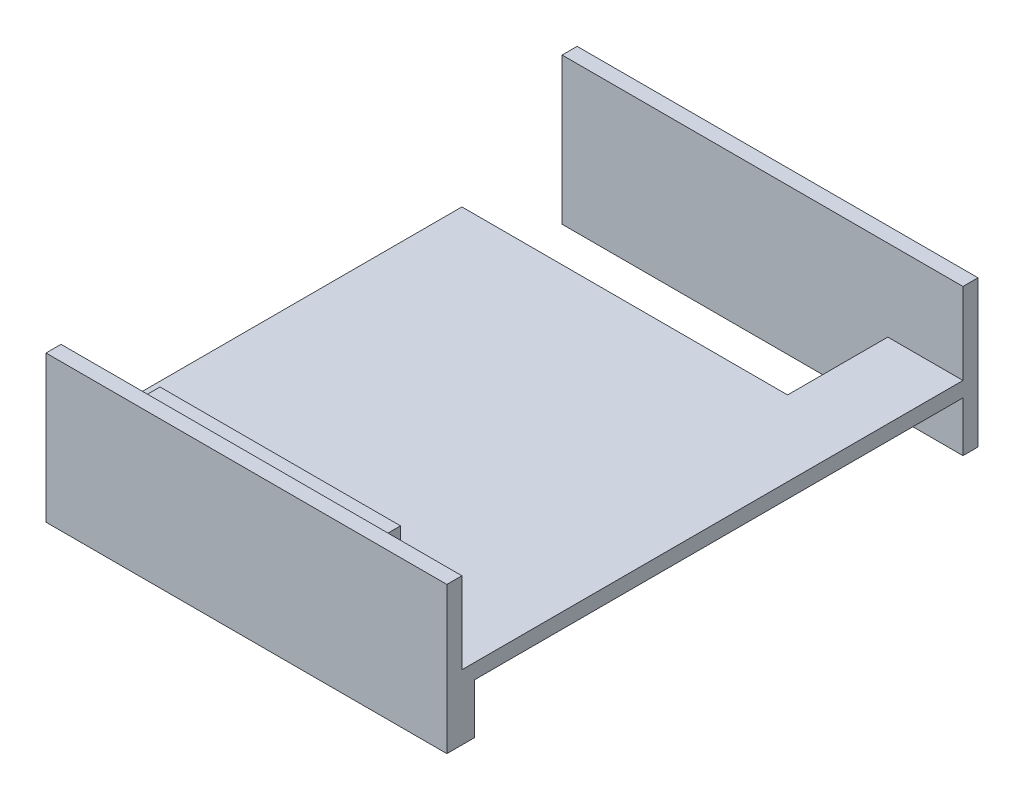
from build123d import *

# Parameters (mm, degrees)
EXTRUDE_309_DEPTH      = 1.2
SKETCH_2_W             = 32
SKETCH_2_H             = 1.2
PCB_DEPTH              = 6.5
PCB_2_DEPTH            = 6
CUT_EXTRUDE_1014_REACH = 54.571
SKETCH_5_W             = 32
SKETCH_5_H             = 1.2
EXTRUDE_1369_DEPTH     = 4


with BuildPart() as part:
    # 草图1 → Extrude 309 (new body)
    with BuildSketch(Plane(origin=(0, 0, 0), x_dir=(1, 0, 0), z_dir=(0, 1, 0))):
        Polygon((32, 0), (32, 40), (32, 41.2), (0, 41.2), (0, 40), (0, 0), (0, -1.2), (32, -1.2), align=None)
    extrude(amount=EXTRUDE_309_DEPTH)

    # 草图2 → PCB (add)
    with BuildSketch(Plane(origin=(0, 1.2, 0), x_dir=(1, 0, 0), z_dir=(0, 1, 0))):
        with Locations((16, -0.6)):
            Rectangle(SKETCH_2_W, SKETCH_2_H)
        with Locations((16, 40.6)):
            Rectangle(SKETCH_2_W, SKETCH_2_H)
    extrude(amount=PCB_DEPTH)

    # 草图3 → PCB 2 (add)
    with BuildSketch(Plane(origin=(0, 1.2, 0), x_dir=(1, 0, 0), z_dir=(0, 1, 0))):
        Polygon((16, 0), (25.6, 0), (25.6, 1.5), (6.4, 1.5), (6.4, 0), align=None)
    extrude(amount=PCB_2_DEPTH)

    # 草图4 → Cut-Extrude 1014 (cut, up to next)
    with BuildSketch(Plane(origin=(0, 1.2, 0), x_dir=(1, 0, 0), z_dir=(0, 1, 0)), mode=Mode.PRIVATE) as cut_extrude_1014_sk1:
        Polygon((16, 40), (26, 40), (26, 32), (0, 32), (0, 40), align=None)
    cut_extrude_1014_tool1 = extrude(cut_extrude_1014_sk1.sketch, amount=-CUT_EXTRUDE_1014_REACH, mode=Mode.PRIVATE) & part.part
    add(cut_extrude_1014_tool1.solids().sort_by_distance((13, 1.2, -36))[0], mode=Mode.SUBTRACT)

    # 草图5 → Extrude 1369 (add)
    with BuildSketch(Plane.XZ):
        Polygon((0, 1.2), (0, 0), (0, -1), (32, -1), (32, 0), (32, 1.2), align=None)
        with Locations((16, -40.6)):
            Rectangle(SKETCH_5_W, SKETCH_5_H)
    extrude(amount=EXTRUDE_1369_DEPTH)


solid = part.part
